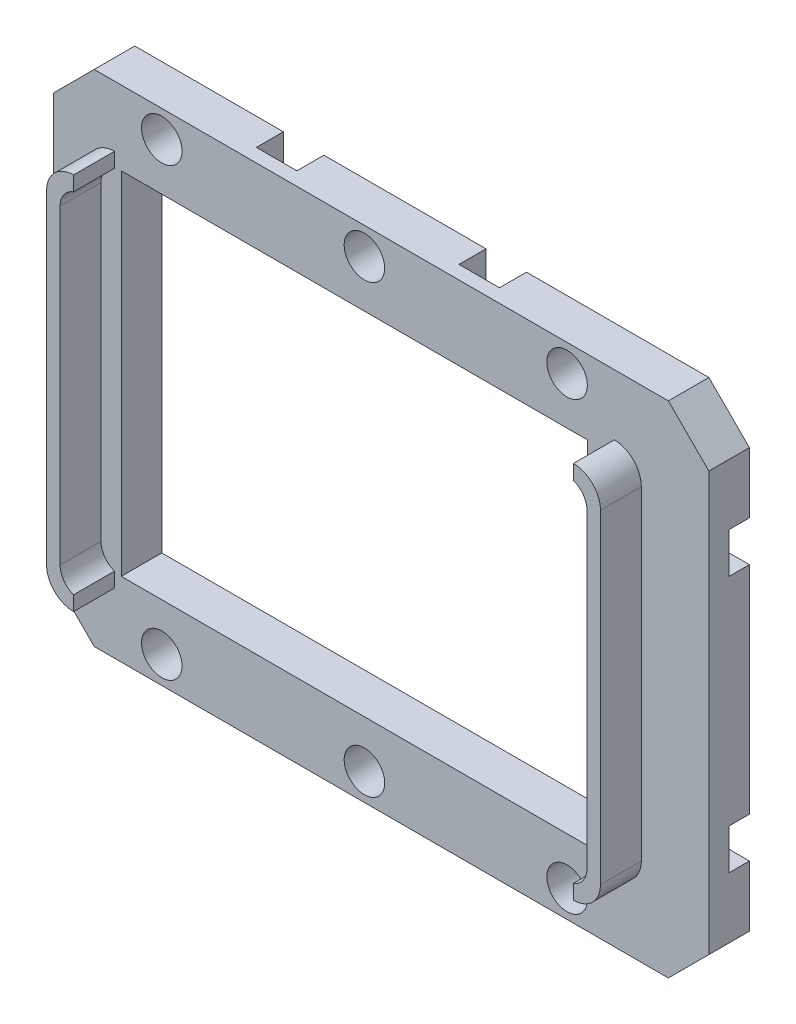
from build123d import *

# Parameters (mm, degrees)
SKETCH_1_W                = 48.5
SKETCH_1_H                = 37
EXTRUDE_1_DEPTH           = 3
SKETCH_2_W                = 21.920667416
SKETCH_2_H                = 2.787
CUT_EXTRUDE_1_DEPTH       = 32.646484797
SKETCH_6_W                = 21.920667416
SKETCH_6_H                = 2.787
CUT_EXTRUDE_5_DEPTH       = 32.646484797
EXTRUDE_2_DEPTH           = 3.028
EXTRUDE_3_DEPTH           = 3.028
HOLE_WIZARD_M4_1_D        = 4.447
HOLE_WIZARD_3_0_3_1_D     = 3
HOLE_WIZARD_3_0_3_1_DEPTH = 6.028
SKETCH_13_W               = 34.5
SKETCH_13_H               = 26.000497192
CUT_EXTRUDE_7_DEPTH       = 10
CHAMFER_1_SIZE            = 3
SKETCH_14_W               = 3
SKETCH_14_H               = 4
CUT_EXTRUDE_8_DEPTH       = 2
CHAMFER_2_SIZE            = 3
CHAMFER_2_SIZE_2          = 3.981134465
SKETCH_15_W               = 2
SKETCH_15_H               = 3
CUT_EXTRUDE_9_DEPTH       = 1.5
CHAMFER_3_SIZE            = 2


with BuildPart() as part:
    # 草图1 → 凸台-拉伸1 (new body)
    with BuildSketch(Plane.XY.offset(-11)):
        with Locations((1.25, 0)):
            Rectangle(SKETCH_1_W, SKETCH_1_H)
    extrude(amount=-EXTRUDE_1_DEPTH)

    # 草图2 → 切除-拉伸1 (cut, through all)
    with BuildSketch(Plane(origin=(0, 0, -14), x_dir=(-1, 0, 0), z_dir=(0, 0, -1))):
        with Locations((6.539666292, -11.606748596)):
            Rectangle(SKETCH_2_W, SKETCH_2_H)
    extrude(amount=-CUT_EXTRUDE_1_DEPTH, mode=Mode.SUBTRACT)

    # 草图6 → 切除-拉伸5 (cut, through all)
    with BuildSketch(Plane(origin=(0, 0, -14), x_dir=(-1, 0, 0), z_dir=(0, 0, -1))):
        with Locations((6.539666292, 11.606748596)):
            Rectangle(SKETCH_6_W, SKETCH_6_H)
    extrude(amount=-CUT_EXTRUDE_5_DEPTH, mode=Mode.SUBTRACT)

    # 草图7 → 凸台-拉伸2 (add)
    with BuildSketch(Plane.XY.offset(-11)):
        with BuildLine():
            Line((-20.5, -12), (-20.5, 12))
            ThreePointArc((-20.5, 12), (-19.914213562, 13.414213562), (-18.5, 14))
            Line((-18.5, 14), (-18.5, 12.914213562))
            ThreePointArc((-18.5, 12.914213562), (-19.224744871, 12.366025404), (-19.5, 11.5))
            Line((-19.5, 11.5), (-19.5, -11.5))
            ThreePointArc((-19.5, -11.5), (-19.224744871, -12.366025404), (-18.5, -12.914213562))
            Line((-18.5, -12.914213562), (-18.5, -14))
            ThreePointArc((-18.5, -14), (-19.914213562, -13.414213562), (-20.5, -12))
        make_face()
    extrude(amount=EXTRUDE_2_DEPTH)

    # 草图8 → 凸台-拉伸3 (add)
    with BuildSketch(Plane.XY.offset(-11)):
        with BuildLine():
            Line((19.5, -11.5), (19.5, 11.5))
            ThreePointArc((19.5, 11.5), (19.224744871, 12.366025404), (18.5, 12.914213562))
            Line((18.5, 12.914213562), (18.5, 14))
            ThreePointArc((18.5, 14), (19.914213562, 13.414213562), (20.5, 12))
            Line((20.5, 12), (20.5, -12))
            ThreePointArc((20.5, -12), (19.914213562, -13.414213562), (18.5, -14))
            Line((18.5, -14), (18.5, -12.914213562))
            ThreePointArc((18.5, -12.914213562), (19.224744871, -12.366025404), (19.5, -11.5))
        make_face()
    extrude(amount=EXTRUDE_3_DEPTH)

    # M4 间隙孔1 (through all)
    with Locations(Plane.XY.offset(-11)):
        with Locations((12.25, 6.000000304)):
            Hole(HOLE_WIZARD_M4_1_D / 2)

    # Ø3.0 (3) 直径孔1
    with Locations(Plane(origin=(0, 0, -14), x_dir=(-1, 0, 0), z_dir=(0, 0, -1))):
        with Locations((-15, -16.5), (15, -16.5), (0, -16.5), (-15, 16.5), (15, 16.5), (0, 16.5)):
            Hole(HOLE_WIZARD_3_0_3_1_D / 2, depth=HOLE_WIZARD_3_0_3_1_DEPTH)

    # 草图13 → 切除-拉伸7 (cut, symmetric)
    with BuildSketch(Plane(origin=(0, 0, -14), x_dir=(-1, 0, 0), z_dir=(0, 0, -1))):
        with Locations((0.75, 0)):
            Rectangle(SKETCH_13_W, SKETCH_13_H)
    extrude(amount=CUT_EXTRUDE_7_DEPTH, both=True, mode=Mode.SUBTRACT)

    # 倒角1
    chamfer_1_edges = [part.edges().sort_by_distance(p)[0] for p in [
        (-23, 18.5, -12.5),
        (25.5, 18.5, -12.5),
        (25.5, -18.5, -12.5),
        (-23, -18.5, -12.5),
    ]]
    chamfer(chamfer_1_edges, length=CHAMFER_1_SIZE)

    # 草图14 → 切除-拉伸8 (cut)
    with BuildSketch(Plane(origin=(0, 0, -14), x_dir=(-1, 0, 0), z_dir=(0, 0, -1))):
        with Locations((-7.5, -16.5)):
            Rectangle(SKETCH_14_W, SKETCH_14_H)
        with Locations((7.5, -16.5)):
            Rectangle(SKETCH_14_W, SKETCH_14_H)
        with Locations((7.5, 16.5)):
            Rectangle(SKETCH_14_W, SKETCH_14_H)
        with Locations((-7.5, 16.5)):
            Rectangle(SKETCH_14_W, SKETCH_14_H)
    extrude(amount=-CUT_EXTRUDE_8_DEPTH, mode=Mode.SUBTRACT)

    # 倒角2
    # the kernel refuses this chamfer: 3.981134465, 3 mm, written as the material it adds along each edge
    with BuildSketch(Plane(origin=(-6, 14.5, -12), x_dir=(0, -0.04104604510109815, -0.9991572559820394), z_dir=(-1, 0, 0))) as chamfer_2_piece_1_section:
        Polygon((CHAMFER_2_SIZE * 0.999157255982, -CHAMFER_2_SIZE * 0.0410460451011), (-CHAMFER_2_SIZE_2 * 0.0410460450997, -CHAMFER_2_SIZE_2 * 0.999157255947), (0, 0), align=None)
    chamfer_2_piece_1 = extrude(amount=3, mode=Mode.PRIVATE)
    chamfer_2_piece_1 = split(chamfer_2_piece_1, bisect_by=Plane(origin=(-7.5, 15.961237376, -14), z_dir=(0, 0, 1)), keep=Keep.TOP, mode=Mode.PRIVATE)
    add(chamfer_2_piece_1)
    with BuildSketch(Plane(origin=(9, 14.5, -12), x_dir=(0, -0.04104604510109815, -0.9991572559820394), z_dir=(-1, 0, 0))) as chamfer_2_piece_2_section:
        Polygon((CHAMFER_2_SIZE * 0.999157255982, -CHAMFER_2_SIZE * 0.0410460451011), (-CHAMFER_2_SIZE_2 * 0.0410460450997, -CHAMFER_2_SIZE_2 * 0.999157255947), (0, 0), align=None)
    chamfer_2_piece_2 = extrude(amount=3, mode=Mode.PRIVATE)
    chamfer_2_piece_2 = split(chamfer_2_piece_2, bisect_by=Plane(origin=(7.5, 15.961237376, -14), z_dir=(0, 0, 1)), keep=Keep.TOP, mode=Mode.PRIVATE)
    add(chamfer_2_piece_2)
    with BuildSketch(Plane(origin=(-9, -14.5, -12), x_dir=(0, -0.9997280272590685, 0.023321052992758363), z_dir=(1, 0, 0))) as chamfer_2_piece_3_section:
        Polygon((CHAMFER_2_SIZE_2 * 0.999728027224, CHAMFER_2_SIZE_2 * 0.0233210529919), (-CHAMFER_2_SIZE * 0.0233210529928, CHAMFER_2_SIZE * 0.999728027259), (0, 0), align=None)
    chamfer_2_piece_3 = extrude(amount=3, mode=Mode.PRIVATE)
    chamfer_2_piece_3 = split(chamfer_2_piece_3, bisect_by=Plane(origin=(-7.5, -15.961237376, -14), z_dir=(0, 0, 1)), keep=Keep.TOP, mode=Mode.PRIVATE)
    add(chamfer_2_piece_3)
    with BuildSketch(Plane(origin=(6, -14.5, -12), x_dir=(0, -0.9997280272590685, 0.023321052992758374), z_dir=(1, 0, 0))) as chamfer_2_piece_4_section:
        Polygon((CHAMFER_2_SIZE_2 * 0.999728027224, CHAMFER_2_SIZE_2 * 0.0233210529919), (-CHAMFER_2_SIZE * 0.0233210529928, CHAMFER_2_SIZE * 0.999728027259), (0, 0), align=None)
    chamfer_2_piece_4 = extrude(amount=3, mode=Mode.PRIVATE)
    chamfer_2_piece_4 = split(chamfer_2_piece_4, bisect_by=Plane(origin=(7.5, -15.961237376, -14), z_dir=(0, 0, 1)), keep=Keep.TOP, mode=Mode.PRIVATE)
    add(chamfer_2_piece_4)

    # 草图15 → 切除-拉伸9 (cut)
    with BuildSketch(Plane(origin=(0, 0, -14), x_dir=(-1, 0, 0), z_dir=(0, 0, -1))):
        with Locations((-24.5, -9.5)):
            Rectangle(SKETCH_15_W, SKETCH_15_H)
        with Locations((-24.5, 9.5)):
            Rectangle(SKETCH_15_W, SKETCH_15_H)
        with Locations((22, 9.5)):
            Rectangle(SKETCH_15_W, SKETCH_15_H)
        with Locations((22, -9.5)):
            Rectangle(SKETCH_15_W, SKETCH_15_H)
    extrude(amount=-CUT_EXTRUDE_9_DEPTH, mode=Mode.SUBTRACT)

    # 倒角3
    # the kernel refuses this chamfer: 2 mm, written as the material it adds along each edge
    with BuildSketch(Plane(origin=(-21, 2.856634024, -12.5), x_dir=(0.027495876610585623, 0, -0.9996219169112968), z_dir=(0, 1, 0))) as chamfer_3_piece_1_section:
        Polygon((CHAMFER_3_SIZE * 0.999621916911, CHAMFER_3_SIZE * 0.0274958766106), (-CHAMFER_3_SIZE * 0.0274958766106, CHAMFER_3_SIZE * 0.999621916911), (0, 0), align=None)
    chamfer_3_piece_1 = extrude(amount=13.286731952, mode=Mode.PRIVATE)
    chamfer_3_piece_1 = split(chamfer_3_piece_1, bisect_by=Plane(origin=(-21.7, 9.5, -14), z_dir=(0, 0, 1)), keep=Keep.TOP, mode=Mode.PRIVATE)
    chamfer_3_piece_1 = split(chamfer_3_piece_1, bisect_by=Plane(origin=(-25.35, 13.15, -13.1), z_dir=(0.7071067811865476, -0.7071067811865476, 0)), keep=Keep.TOP, mode=Mode.PRIVATE)
    add(chamfer_3_piece_1)
    with BuildSketch(Plane(origin=(-21, -2.856634024, -12.5), x_dir=(0.027495876610585623, 0, -0.9996219169112968), z_dir=(0, -1, 0))) as chamfer_3_piece_2_section:
        Polygon((CHAMFER_3_SIZE * 0.999621916911, -CHAMFER_3_SIZE * 0.0274958766106), (-CHAMFER_3_SIZE * 0.0274958766106, -CHAMFER_3_SIZE * 0.999621916911), (0, 0), align=None)
    chamfer_3_piece_2 = extrude(amount=8.143365976, mode=Mode.PRIVATE)
    chamfer_3_piece_2 = split(chamfer_3_piece_2, bisect_by=Plane(origin=(-21.7, -9.5, -14), z_dir=(0, 0, 1)), keep=Keep.TOP, mode=Mode.PRIVATE)
    add(chamfer_3_piece_2)
    with BuildSketch(Plane(origin=(23.5, 2.856634024, -12.5), x_dir=(-0.027495876610585623, 0, -0.9996219169112968), z_dir=(0, 1, 0))) as chamfer_3_piece_3_section:
        Polygon((CHAMFER_3_SIZE * 0.999621916911, -CHAMFER_3_SIZE * 0.0274958766106), (-CHAMFER_3_SIZE * 0.0274958766106, -CHAMFER_3_SIZE * 0.999621916911), (0, 0), align=None)
    chamfer_3_piece_3 = extrude(amount=8.143365976, mode=Mode.PRIVATE)
    chamfer_3_piece_3 = split(chamfer_3_piece_3, bisect_by=Plane(origin=(24.2, 9.5, -14), z_dir=(0, 0, 1)), keep=Keep.TOP, mode=Mode.PRIVATE)
    add(chamfer_3_piece_3)
    with BuildSketch(Plane(origin=(23.5, -2.856634024, -12.5), x_dir=(-0.027495876610585623, 0, -0.9996219169112968), z_dir=(0, -1, 0))) as chamfer_3_piece_4_section:
        Polygon((CHAMFER_3_SIZE * 0.999621916911, CHAMFER_3_SIZE * 0.0274958766106), (-CHAMFER_3_SIZE * 0.0274958766106, CHAMFER_3_SIZE * 0.999621916911), (0, 0), align=None)
    chamfer_3_piece_4 = extrude(amount=13.286731952, mode=Mode.PRIVATE)
    chamfer_3_piece_4 = split(chamfer_3_piece_4, bisect_by=Plane(origin=(24.2, -9.5, -14), z_dir=(0, 0, 1)), keep=Keep.TOP, mode=Mode.PRIVATE)
    chamfer_3_piece_4 = split(chamfer_3_piece_4, bisect_by=Plane(origin=(27.85, -13.15, -13.1), z_dir=(-0.7071067811865476, 0.7071067811865476, 0)), keep=Keep.TOP, mode=Mode.PRIVATE)
    add(chamfer_3_piece_4)


solid = part.part
